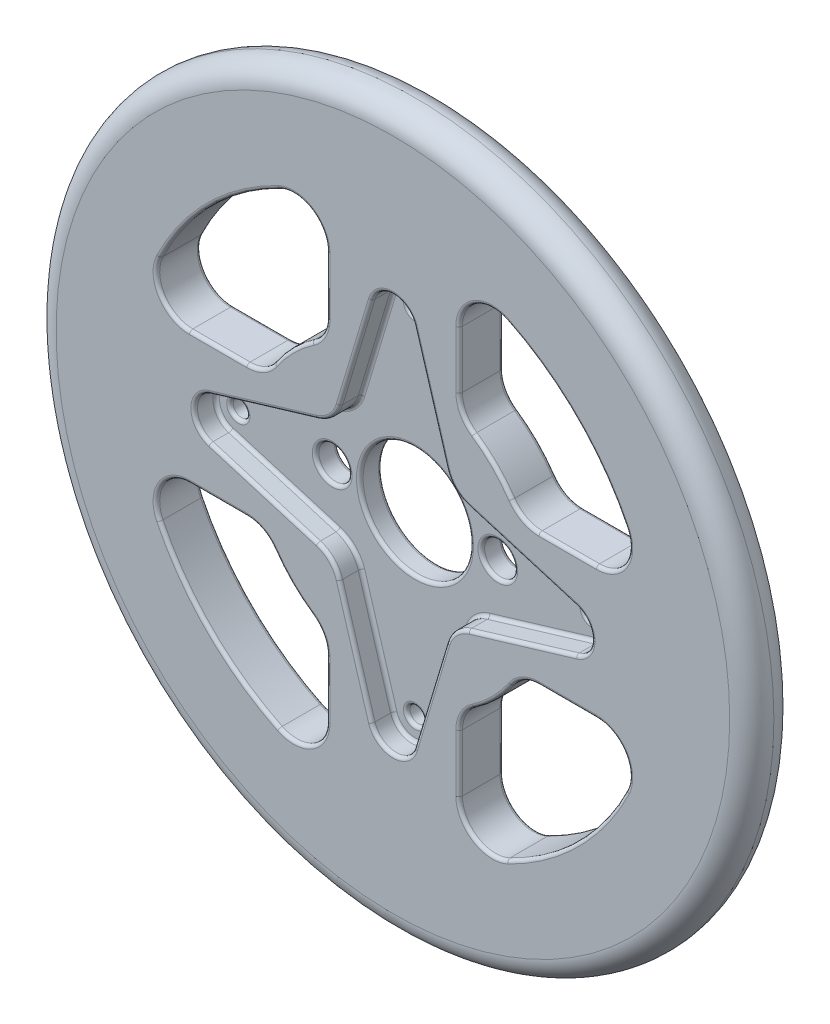
from build123d import *

# Parameters (mm, degrees)
ESQUISSE1_R                        = 32.5
BOSS_EXTRU_1_DEPTH                 = 4
CONG_1_R                           = 2
ESQUISSE2_R                        = 1.5
ESQUISSE2_R_2                      = 5
ENL_V_MAT_EXTRU_1_DEPTH            = 4
ENL_V_MAT_EXTRU_3_DEPTH            = 4
CONG_2_R                           = 3
R_P_TITION_CIRCULAIRE1_COUNT       = 4
CONG_2_OF_R_P_TITION_CIRCULAIRE1_R = 3
ESQUISSE4_R                        = 1.5
ESQUISSE4_R_2                      = 2
ESQUISSE4_R_3                      = 0.75
ENL_V_MAT_EXTRU_4_DEPTH            = 2
ESQUISSE5_R                        = 0.75
ENL_V_MAT_EXTRU_5_DEPTH            = 47.135669568
CONG_3_R                           = 3
CONG_4_R                           = 0.3


with BuildPart() as part:
    # Esquisse1 → Boss.-Extru.1 (new body)
    with BuildSketch(Plane.XY):
        Circle(ESQUISSE1_R)
    extrude(amount=BOSS_EXTRU_1_DEPTH)

    # Congé1
    cong_1_edges = [part.edges().sort_by_distance(p)[0] for p in [
        (-32.5, 0, 0),
        (-32.5, 0, 4),
    ]]
    fillet(cong_1_edges, radius=CONG_1_R - 0.0001)  # a hair under: the kernel refuses the full size

    # Esquisse2 → Enlèv. mat.-Extru.1 (cut)
    with BuildSketch(Plane.XY.offset(4)):
        with Locations((-7.5, 0)):
            Circle(ESQUISSE2_R)
        with Locations((7.5, 0)):
            Circle(ESQUISSE2_R)
        Circle(ESQUISSE2_R_2)
    extrude(amount=-ENL_V_MAT_EXTRU_1_DEPTH, mode=Mode.SUBTRACT)

    # Esquisse3 → Enlèv. mat.-Extru.3 (cut)
    with BuildSketch(Plane.XY.offset(4)):
        with BuildLine():
            Line((11.532562595, 6), (22.721135535, 6))
            ThreePointArc((22.721135535, 6), (16.617009358, 16.617009358), (6, 22.721135535))
            Line((6, 22.721135535), (6, 11.532562595))
            ThreePointArc((6, 11.532562595), (9.192388155, 9.192388155), (11.532562595, 6))
        make_face()
    enl_v_mat_extru_3 = extrude(amount=-ENL_V_MAT_EXTRU_3_DEPTH, mode=Mode.SUBTRACT)

    # Congé2
    cong_2_edges = [part.edges().sort_by_distance(p)[0] for p in [
        (11.532562595, 6, 2),
        (6, 11.532562595, 2),
        (6, 22.721135535, 2),
        (22.721135535, 6, 2),
    ]]
    fillet(cong_2_edges, radius=CONG_2_R)

    # Répétition circulaire1: Enlèv. mat.-Extru.3 ×4 about axis
    r_p_tition_circulaire1_axis = Axis((0, 0, 0), (0, 0, 1))
    for i in range(1, R_P_TITION_CIRCULAIRE1_COUNT):
        add(enl_v_mat_extru_3.rotate(r_p_tition_circulaire1_axis, i * 360 / R_P_TITION_CIRCULAIRE1_COUNT), mode=Mode.SUBTRACT)

    # Congé2 of Répétition circulaire1
    cong_2_of_r_p_tition_circulaire1_edges = [part.edges().sort_by_distance(p)[0] for p in [
        (-6, 11.532562595, 2),
        (-11.532562595, 6, 2),
        (-22.721135535, 6, 2),
        (-6, 22.721135535, 2),
        (-11.532562595, -6, 2),
        (-6, -11.532562595, 2),
        (-6, -22.721135535, 2),
        (-22.721135535, -6, 2),
        (6, -11.532562595, 2),
        (11.532562595, -6, 2),
        (22.721135535, -6, 2),
        (6, -22.721135535, 2),
    ]]
    fillet(cong_2_of_r_p_tition_circulaire1_edges, radius=CONG_2_OF_R_P_TITION_CIRCULAIRE1_R)

    # Esquisse4 → Enlèv. mat.-Extru.4 (cut)
    # profile 1 of 5: a face of its own
    with BuildSketch(Plane.XY.offset(4)):
        with BuildLine():
            ThreePointArc((2, 16), (-0.290927881, 14.021272892), (-1.915360968, 16.575666884))
            Line((-1.915360968, 16.575666884), (-5.303300859, 5.303300859))
            Line((-5.303300859, 5.303300859), (-16.575666884, 1.915360968))
            ThreePointArc((-16.575666884, 1.915360968), (-14.806545721, 1.604888434), (-14, 0))
            ThreePointArc((-14, 0), (-14.806545721, -1.604888434), (-16.575666884, -1.915360968))
            Line((-16.575666884, -1.915360968), (-5.303300859, -5.303300859))
            Line((-5.303300859, -5.303300859), (-1.915360968, -16.575666884))
            ThreePointArc((-1.915360968, -16.575666884), (-0.290927881, -14.021272892), (2, -16))
            ThreePointArc((2, -16), (1.978727108, -16.290927881), (1.915360968, -16.575666884))
            Line((1.915360968, -16.575666884), (5.303300859, -5.303300859))
            Line((5.303300859, -5.303300859), (16.575666884, -1.915360968))
            ThreePointArc((16.575666884, -1.915360968), (14, 0), (16.575666884, 1.915360968))
            Line((16.575666884, 1.915360968), (5.303300859, 5.303300859))
            Line((5.303300859, 5.303300859), (1.915360968, 16.575666884))
            ThreePointArc((1.915360968, 16.575666884), (1.978727108, 16.290927881), (2, 16))
        make_face()
        with Locations((-7.5, 0)):
            Circle(ESQUISSE4_R, mode=Mode.SUBTRACT)
        with Locations((7.5, 0)):
            Circle(ESQUISSE4_R, mode=Mode.SUBTRACT)
    # profile 2 of 5: a face of its own
    with BuildSketch(Plane.XY.offset(4)):
        with Locations((0, 16)):
            Circle(ESQUISSE4_R_2)
        with Locations((0, 16)):
            Circle(ESQUISSE4_R_3, mode=Mode.SUBTRACT)
    # profile 3 of 5: a face of its own
    with BuildSketch(Plane.XY.offset(4)):
        with Locations((-16, 0)):
            Circle(ESQUISSE4_R_2)
        with Locations((-16, 0)):
            Circle(ESQUISSE4_R_3, mode=Mode.SUBTRACT)
    # profile 4 of 5: a face of its own
    with BuildSketch(Plane.XY.offset(4)):
        with Locations((16, 0)):
            Circle(ESQUISSE4_R_2)
        with Locations((16, 0)):
            Circle(ESQUISSE4_R_3, mode=Mode.SUBTRACT)
    # profile 5 of 5: a face of its own
    with BuildSketch(Plane.XY.offset(4)):
        with Locations((0, -16)):
            Circle(ESQUISSE4_R_2)
        with Locations((0, -16)):
            Circle(ESQUISSE4_R_3, mode=Mode.SUBTRACT)
    extrude(amount=-ENL_V_MAT_EXTRU_4_DEPTH, mode=Mode.SUBTRACT)

    # Esquisse5 → Enlèv. mat.-Extru.5 (cut, through all)
    with BuildSketch(Plane.XY.offset(4)):
        with Locations((-16, 0)):
            Circle(ESQUISSE5_R)
        with Locations((0, 16)):
            Circle(ESQUISSE5_R)
        with Locations((16, 0)):
            Circle(ESQUISSE5_R)
        with Locations((0, -16)):
            Circle(ESQUISSE5_R)
    extrude(amount=-ENL_V_MAT_EXTRU_5_DEPTH, mode=Mode.SUBTRACT)

    # Congé3
    cong_3_edges = [part.edges().sort_by_distance(p)[0] for p in [
        (-5.303300859, -5.303300859, 3),
        (-5.303300859, 5.303300859, 3),
        (5.303300859, 5.303300859, 3),
        (5.303300859, -5.303300859, 3),
    ]]
    fillet(cong_3_edges, radius=CONG_3_R)

    # Congé4
    cong_4_edges = [part.edges().sort_by_distance(p)[0] for p in [
        (-16.617009358, 16.617009358, 4),
        (-16.617009358, 16.617009358, 0),
        (-6, 15.823748506, 4),
        (-6, 15.823748506, 0),
        (-15.823748506, 6, 4),
        (-15.823748506, 6, 0),
        (-9, 0, 0),
        (-9.192388155, 9.192388155, 4),
        (-9.192388155, 9.192388155, 0),
        (-7.411167018, 20.963462397, 4),
        (-7.411167018, 20.963462397, 0),
        (-20.963462397, 7.411167018, 4),
        (-20.963462397, 7.411167018, 0),
        (-6.348349571, 11.825635035, 4),
        (-6.348349571, 11.825635035, 0),
        (-11.825635035, 6.348349571, 4),
        (-11.825635035, 6.348349571, 0),
        (-16.617009358, -16.617009358, 4),
        (-16.617009358, -16.617009358, 0),
        (-15.823748506, -6, 4),
        (-15.823748506, -6, 0),
        (-6, -15.823748506, 4),
        (-6, -15.823748506, 0),
        (-9.192388155, -9.192388155, 4),
        (-9.192388155, -9.192388155, 0),
        (-20.963462397, -7.411167018, 4),
        (-20.963462397, -7.411167018, 0),
        (-7.411167018, -20.963462397, 4),
        (-7.411167018, -20.963462397, 0),
        (-11.825635035, -6.348349571, 4),
        (-11.825635035, -6.348349571, 0),
        (-6.348349571, -11.825635035, 4),
        (-6.348349571, -11.825635035, 0),
        (16.617009358, -16.617009358, 4),
        (16.617009358, -16.617009358, 0),
        (6, -15.823748506, 4),
        (6, -15.823748506, 0),
        (6, 0, 0),
        (15.823748506, -6, 4),
        (15.823748506, -6, 0),
        (9.192388155, -9.192388155, 4),
        (9.192388155, -9.192388155, 0),
        (7.411167018, -20.963462397, 4),
        (7.411167018, -20.963462397, 0),
        (20.963462397, -7.411167018, 4),
        (20.963462397, -7.411167018, 0),
        (6.348349571, -11.825635035, 4),
        (6.348349571, -11.825635035, 0),
        (11.825635035, -6.348349571, 4),
        (11.825635035, -6.348349571, 0),
        (-5, 0, 0),
        (-3.37713233, -11.712055851, 4),
        (-11.712055851, -3.37713233, 2),
        (-18, 0, 2),
        (-11.712055851, 3.37713233, 4),
        (-3.37713233, 11.712055851, 2),
        (0, 18, 2),
        (3.37713233, 11.712055851, 4),
        (11.712055851, 3.37713233, 2),
        (18, 0, 2),
        (11.712055851, -3.37713233, 4),
        (3.37713233, -11.712055851, 2),
        (6, 0, 2),
        (-9, 0, 2),
        (-5, 0, 2),
        (0, -18, 2),
        (-3.37713233, -11.712055851, 2),
        (-11.712055851, 3.37713233, 2),
        (3.37713233, 11.712055851, 2),
        (11.712055851, -3.37713233, 2),
        (0, -18, 4),
        (3.37713233, -11.712055851, 4),
        (18, 0, 4),
        (11.712055851, 3.37713233, 4),
        (0, 18, 4),
        (-3.37713233, 11.712055851, 4),
        (-18, 0, 4),
        (-11.712055851, -3.37713233, 4),
        (-16.75, 0, 2),
        (-16.75, 0, 0),
        (-0.75, 16, 2),
        (-0.75, 16, 0),
        (15.25, 0, 2),
        (15.25, 0, 0),
        (-0.75, -16, 2),
        (-0.75, -16, 0),
        (5.5906248, 5.5906248, 4),
        (5.5906248, -5.5906248, 4),
        (-5.5906248, -5.5906248, 4),
        (-5.5906248, 5.5906248, 4),
        (-5.5906248, 5.5906248, 2),
        (-5.5906248, -5.5906248, 2),
        (5.5906248, -5.5906248, 2),
        (5.5906248, 5.5906248, 2),
        (16.617009358, 16.617009358, 4),
        (16.617009358, 16.617009358, 0),
        (15.823748506, 6, 4),
        (15.823748506, 6, 0),
        (6, 15.823748506, 4),
        (6, 15.823748506, 0),
        (9.192388155, 9.192388155, 4),
        (9.192388155, 9.192388155, 0),
        (20.963462397, 7.411167018, 4),
        (20.963462397, 7.411167018, 0),
        (7.411167018, 20.963462397, 4),
        (7.411167018, 20.963462397, 0),
        (11.825635035, 6.348349571, 4),
        (11.825635035, 6.348349571, 0),
        (6.348349571, 11.825635035, 4),
        (6.348349571, 11.825635035, 0),
    ]]
    fillet(cong_4_edges, radius=CONG_4_R)


solid = part.part
